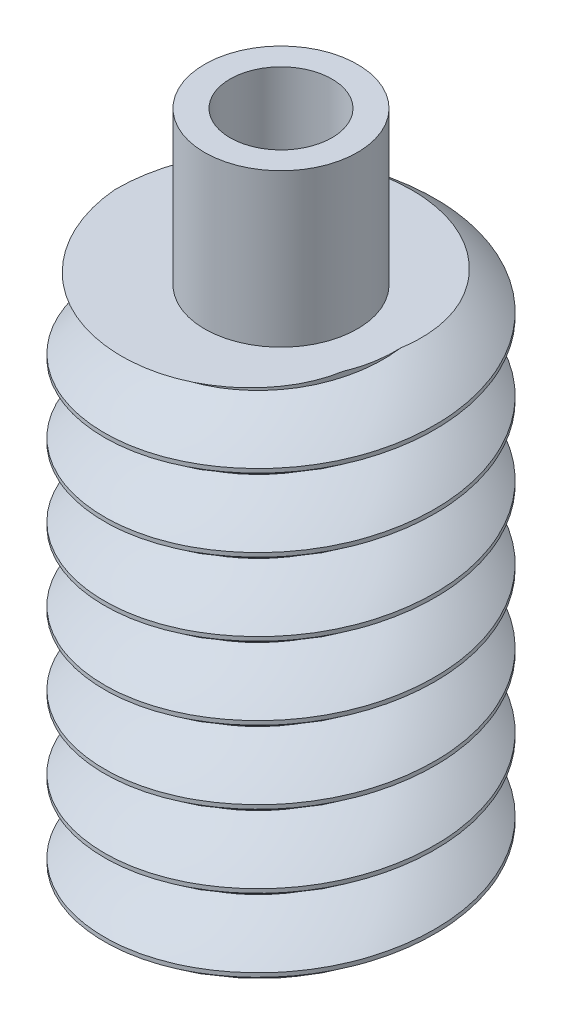
from build123d import *

# Parameters (mm, degrees)
SKETCH1_R           = 3.25
BOSS_EXTRUDE1_DEPTH = 10
CUT_SWEEP1_PITCH    = 1.428571429
SKETCH4_R           = 1.5
CUT_EXTRUDE1_DEPTH  = 12.005680501
SKETCH5_R           = 1.5
BOSS_EXTRUDE3_DEPTH = 3
SKETCH6_R           = 1
CUT_EXTRUDE2_DEPTH  = 14.788582375


with BuildPart() as part:
    # Sketch1 → Boss-Extrude1 (new body)
    with BuildSketch(Plane(origin=(0, 0, 0), x_dir=(1, 0, 0), z_dir=(0, 1, 0))):
        with Locations(Location((0, 0, 0), (0, 0, 270))):
            Circle(SKETCH1_R)
    extrude(amount=BOSS_EXTRUDE1_DEPTH)

    # Cut-Sweep1: arcs per turn and ends read off the stored shape
    # Cut-Sweep1: the profile of Sketch3 profile screwed along a right-hand helix through 8.5 turns, 8 arcs to a turn; built about Z, then put on its axis
    cut_sweep1_z = Axis((0, 0, 0), (0, 0, 1))
    cut_sweep1_corners = [(3.2503, 0, -0.078571429), (3.2503, 0, -1.428571429), (3.25, 0, -1.428571429), (2.25, 0, -0.803571429), (2.25, 0, -0.703571429), (3.25, 0, -0.078571429)]
    with BuildLine(mode=Mode.PRIVATE) as cut_sweep1_profile:
        Line(cut_sweep1_corners[0], cut_sweep1_corners[1])
        Line(cut_sweep1_corners[3], cut_sweep1_corners[4])
        Line(cut_sweep1_corners[5], cut_sweep1_corners[0])
        Line(cut_sweep1_corners[2], cut_sweep1_corners[1])
        ThreePointArc((3.25, 0, -1.428571429), (2.771740146, 0, -1.081287195), (2.25, 0, -0.803571429))
        ThreePointArc((2.25, 0, -0.703571429), (2.771740146, 0, -0.425855662), (3.25, 0, -0.078571429))
    cut_sweep1_cap = Face(cut_sweep1_profile.wire())
    cut_sweep1_arcs = [((3.25, 0, -1.428571429), (2.79369175, 0, -1.046164629), (2.25, 0, -0.803571429), (1, 0.990367077997929, 1)), ((2.25, 0, -0.703571429), (2.79369175, 0, -0.460978228), (3.25, 0, -0.078571429), (1, 0.9903670779979299, 1))]  # start, shoulder, end, weights
    cut_sweep1_turn_angles = [0, 22.5, 45, 67.5, 90, 112.5, 135, 157.5, 180, 202.5, 225, 247.5, 270, 292.5, 315, 337.5, 360]
    cut_sweep1_turn_weights = [1, 0.9238795325112867, 1, 0.9238795325112867, 1, 0.9238795325112867, 1, 0.9238795325112867, 1, 0.9238795325112867, 1, 0.9238795325112867, 1, 0.9238795325112867, 1, 0.9238795325112867, 1]
    cut_sweep1_turn_rails = [Edge.make_bspline([Vector(p[0], p[1], 0).rotate(cut_sweep1_z, cut_sweep1_turn_angles[k]) / cut_sweep1_turn_weights[k] + Vector(0, 0, p[2] + CUT_SWEEP1_PITCH * cut_sweep1_turn_angles[k] / 360) for k in range(17)], [0, 0, 0, 1, 1, 2, 2, 3, 3, 4, 4, 5, 5, 6, 6, 7, 7, 8, 8, 8], 2, cut_sweep1_turn_weights) for p in cut_sweep1_corners]
    cut_sweep1_turn_sides = [*[Face.make_surface_from_curves(cut_sweep1_turn_rails[p[0]], cut_sweep1_turn_rails[p[1]]) for p in [(0, 1), (3, 4), (5, 0), (2, 1)]], *[Face.make_bezier_surface([[Vector(p[j][0], p[j][1], 0).rotate(cut_sweep1_z, cut_sweep1_turn_angles[2 * i + k]) / cut_sweep1_turn_weights[2 * i + k] + Vector(0, 0, p[j][2] + CUT_SWEEP1_PITCH * cut_sweep1_turn_angles[2 * i + k] / 360) for k in range(3)] for j in range(3)], [[p[3][j] * cut_sweep1_turn_weights[2 * i + k] for k in range(3)] for j in range(3)]) for p in cut_sweep1_arcs for i in range(8)]]
    cut_sweep1_last_angles = [2880, 2902.5, 2925, 2947.5, 2970, 2992.5, 3015, 3037.5, 3060]
    cut_sweep1_last_weights = [1, 0.9238795325112867, 1, 0.9238795325112867, 1, 0.9238795325112867, 1, 0.9238795325112867, 1]
    cut_sweep1_last_rails = [Edge.make_bspline([Vector(p[0], p[1], 0).rotate(cut_sweep1_z, cut_sweep1_last_angles[k]) / cut_sweep1_last_weights[k] + Vector(0, 0, p[2] + CUT_SWEEP1_PITCH * cut_sweep1_last_angles[k] / 360) for k in range(9)], [0, 0, 0, 1, 1, 2, 2, 3, 3, 4, 4, 4], 2, cut_sweep1_last_weights) for p in cut_sweep1_corners]
    cut_sweep1_last_sides = [*[Face.make_surface_from_curves(cut_sweep1_last_rails[p[0]], cut_sweep1_last_rails[p[1]]) for p in [(0, 1), (3, 4), (5, 0), (2, 1)]], *[Face.make_bezier_surface([[Vector(p[j][0], p[j][1], 0).rotate(cut_sweep1_z, cut_sweep1_last_angles[2 * i + k]) / cut_sweep1_last_weights[2 * i + k] + Vector(0, 0, p[j][2] + CUT_SWEEP1_PITCH * cut_sweep1_last_angles[2 * i + k] / 360) for k in range(3)] for j in range(3)], [[p[3][j] * cut_sweep1_last_weights[2 * i + k] for k in range(3)] for j in range(3)]) for p in cut_sweep1_arcs for i in range(4)]]
    cut_sweep1 = Plane(origin=(0, 10, 0), x_dir=(-1, 0, 0), z_dir=(0, -1, 0)) * Solid(Shell([*[p.moved(Location((0, 0, CUT_SWEEP1_PITCH * i))) for i in range(8) for p in cut_sweep1_turn_sides], *cut_sweep1_last_sides, cut_sweep1_cap, cut_sweep1_cap.rotate(cut_sweep1_z, 3060).moved(Location((0, 0, CUT_SWEEP1_PITCH * 3060 / 360)))]))
    add(cut_sweep1, mode=Mode.SUBTRACT)

    # Sketch4 → Cut-Extrude1 (cut, through all)
    with BuildSketch(Plane(origin=(0, 10, 0), x_dir=(1, 0, 0), z_dir=(0, 1, 0))):
        with Locations(Location((0, 0, 0), (0, 0, 270))):
            Circle(SKETCH4_R)
    extrude(amount=-CUT_EXTRUDE1_DEPTH, mode=Mode.SUBTRACT)


with BuildPart() as body_2:
    # Sketch5 → Boss-Extrude3 (new body)
    with BuildSketch(Plane(origin=(0, 10, 0), x_dir=(1, 0, 0), z_dir=(0, 1, 0))):
        with Locations(Location((0, 0, 0), (0, 0, 270))):
            Circle(SKETCH5_R)
    extrude(amount=BOSS_EXTRUDE3_DEPTH)

    # Sketch6 → Cut-Extrude2 (cut, through all)
    with BuildSketch(Plane(origin=(0, 13, 0), x_dir=(1, 0, 0), z_dir=(0, 1, 0))):
        with Locations(Location((0, 0, 0), (0, 0, 270))):
            Circle(SKETCH6_R)
    extrude(amount=-CUT_EXTRUDE2_DEPTH, mode=Mode.SUBTRACT)


solid = Compound([part.part, body_2.part])
